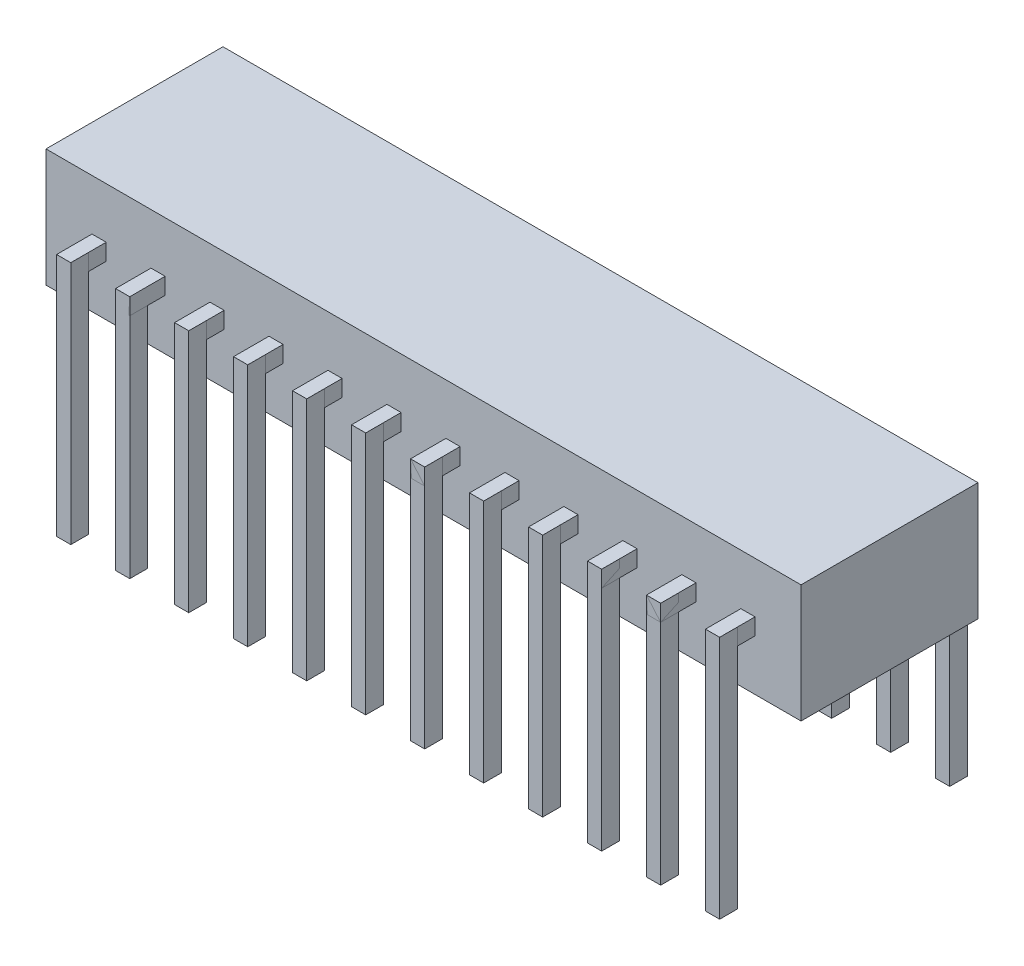
from build123d import *

# Parameters (mm, degrees)
SKETCH2_W                   = 600
SKETCH2_H                   = 1500
BOSS_EXTRUDE1_DEPTH         = 350
BOSS_EXTRUDE1_2_DEPTH       = 350
BOSS_EXTRUDE1_3_DEPTH       = 350
BOSS_EXTRUDE1_4_DEPTH       = 350
BOSS_EXTRUDE1_5_DEPTH       = 350
BOSS_EXTRUDE1_6_DEPTH       = 350
BOSS_EXTRUDE1_7_DEPTH       = 350
BOSS_EXTRUDE1_8_DEPTH       = 350
BOSS_EXTRUDE1_9_DEPTH       = 350
BOSS_EXTRUDE1_10_DEPTH      = 350
BOSS_EXTRUDE1_11_DEPTH      = 350
BOSS_EXTRUDE1_12_DEPTH      = 350
BOSS_EXTRUDE1_13_DEPTH      = 350
BOSS_EXTRUDE1_14_DEPTH      = 350
BOSS_EXTRUDE1_15_DEPTH      = 350
BOSS_EXTRUDE1_16_DEPTH      = 350
BOSS_EXTRUDE1_17_DEPTH      = 350
BOSS_EXTRUDE1_18_DEPTH      = 350
BOSS_EXTRUDE1_19_DEPTH      = 350
BOSS_EXTRUDE1_20_DEPTH      = 350
BOSS_EXTRUDE1_21_DEPTH      = 350
BOSS_EXTRUDE1_22_DEPTH      = 350
BOSS_EXTRUDE1_23_DEPTH      = 350
BOSS_EXTRUDE1_24_DEPTH      = 350
BOSS_EXTRUDE2_DEPTH         = 345
BOSS_EXTRUDE2_DEPTH_BACK    = 10000
SKETCH2_16_W                = 600
SKETCH2_16_H                = 750
BOSS_EXTRUDE2_2_DEPTH       = 345
BOSS_EXTRUDE2_2_DEPTH_BACK  = 10000
BOSS_EXTRUDE2_3_DEPTH       = 345
BOSS_EXTRUDE2_3_DEPTH_BACK  = 10000
BOSS_EXTRUDE2_4_DEPTH       = 345
BOSS_EXTRUDE2_4_DEPTH_BACK  = 10000
BOSS_EXTRUDE2_5_DEPTH       = 345
BOSS_EXTRUDE2_5_DEPTH_BACK  = 10000
BOSS_EXTRUDE2_6_DEPTH       = 345
BOSS_EXTRUDE2_6_DEPTH_BACK  = 10000
BOSS_EXTRUDE2_7_DEPTH       = 345
BOSS_EXTRUDE2_7_DEPTH_BACK  = 10000
BOSS_EXTRUDE2_8_DEPTH       = 345
BOSS_EXTRUDE2_8_DEPTH_BACK  = 10000
BOSS_EXTRUDE2_9_DEPTH       = 345
BOSS_EXTRUDE2_9_DEPTH_BACK  = 10000
BOSS_EXTRUDE2_10_DEPTH      = 345
BOSS_EXTRUDE2_10_DEPTH_BACK = 10000
BOSS_EXTRUDE2_11_DEPTH      = 345
BOSS_EXTRUDE2_11_DEPTH_BACK = 10000
BOSS_EXTRUDE2_12_DEPTH      = 345
BOSS_EXTRUDE2_12_DEPTH_BACK = 10000
BOSS_EXTRUDE2_13_DEPTH      = 345
BOSS_EXTRUDE2_13_DEPTH_BACK = 10000
BOSS_EXTRUDE2_14_DEPTH      = 345
BOSS_EXTRUDE2_14_DEPTH_BACK = 10000
BOSS_EXTRUDE2_15_DEPTH      = 345
BOSS_EXTRUDE2_15_DEPTH_BACK = 10000
BOSS_EXTRUDE2_16_DEPTH      = 345
BOSS_EXTRUDE2_16_DEPTH_BACK = 10000
BOSS_EXTRUDE2_17_DEPTH      = 345
BOSS_EXTRUDE2_17_DEPTH_BACK = 10000
BOSS_EXTRUDE2_18_DEPTH      = 345
BOSS_EXTRUDE2_18_DEPTH_BACK = 10000
BOSS_EXTRUDE2_19_DEPTH      = 345
BOSS_EXTRUDE2_19_DEPTH_BACK = 10000
BOSS_EXTRUDE2_20_DEPTH      = 345
BOSS_EXTRUDE2_20_DEPTH_BACK = 10000
BOSS_EXTRUDE2_21_DEPTH      = 345
BOSS_EXTRUDE2_21_DEPTH_BACK = 10000
BOSS_EXTRUDE2_22_DEPTH      = 345
BOSS_EXTRUDE2_22_DEPTH_BACK = 10000
BOSS_EXTRUDE2_23_DEPTH      = 345
BOSS_EXTRUDE2_23_DEPTH_BACK = 10000
BOSS_EXTRUDE2_24_DEPTH      = 345
BOSS_EXTRUDE2_24_DEPTH_BACK = 10000
BOSS_EXTRUDE3_DEPTH         = 2500


with BuildPart() as part:
    # Sketch2 → Boss-Extrude1 (new, symmetric)
    with BuildSketch(Plane(origin=(0, 0, 0), x_dir=(1, 0, 0), z_dir=(0, 1, 0))):
        with Locations((-5559.113014932, 2882.222515523)):
            Rectangle(SKETCH2_W, SKETCH2_H)
    extrude(amount=BOSS_EXTRUDE1_DEPTH, both=True)


with BuildPart() as body_2:
    # Sketch2 → Boss-Extrude1 2 (new, symmetric)
    with BuildSketch(Plane(origin=(0, 0, 0), x_dir=(1, 0, 0), z_dir=(0, 1, 0))):
        with Locations((-559.113014932, 2882.222515523)):
            Rectangle(SKETCH2_W, SKETCH2_H)
    extrude(amount=BOSS_EXTRUDE1_2_DEPTH, both=True)


with BuildPart() as body_3:
    # Sketch2 → Boss-Extrude1 3 (new, symmetric)
    with BuildSketch(Plane(origin=(0, 0, 0), x_dir=(1, 0, 0), z_dir=(0, 1, 0))):
        with Locations((-3059.113014932, 2882.222515523)):
            Rectangle(SKETCH2_W, SKETCH2_H)
    extrude(amount=BOSS_EXTRUDE1_3_DEPTH, both=True)


with BuildPart() as body_4:
    # Sketch2 → Boss-Extrude1 4 (new, symmetric)
    with BuildSketch(Plane(origin=(0, 0, 0), x_dir=(1, 0, 0), z_dir=(0, 1, 0))):
        with Locations((-8059.113014932, 2882.222515523)):
            Rectangle(SKETCH2_W, SKETCH2_H)
    extrude(amount=BOSS_EXTRUDE1_4_DEPTH, both=True)


with BuildPart() as body_5:
    # Sketch2 → Boss-Extrude1 5 (new, symmetric)
    with BuildSketch(Plane(origin=(0, 0, 0), x_dir=(1, 0, 0), z_dir=(0, 1, 0))):
        with Locations((-10559.113014932, 2882.222515523)):
            Rectangle(SKETCH2_W, SKETCH2_H)
    extrude(amount=BOSS_EXTRUDE1_5_DEPTH, both=True)


with BuildPart() as body_6:
    # Sketch2 → Boss-Extrude1 6 (new, symmetric)
    with BuildSketch(Plane(origin=(0, 0, 0), x_dir=(1, 0, 0), z_dir=(0, 1, 0))):
        with Locations((-13059.113014932, 2882.222515523)):
            Rectangle(SKETCH2_W, SKETCH2_H)
    extrude(amount=BOSS_EXTRUDE1_6_DEPTH, both=True)


with BuildPart() as body_7:
    # Sketch2 → Boss-Extrude1 7 (new, symmetric)
    with BuildSketch(Plane(origin=(0, 0, 0), x_dir=(1, 0, 0), z_dir=(0, 1, 0))):
        with Locations((-15559.113014932, 2882.222515523)):
            Rectangle(SKETCH2_W, SKETCH2_H)
    extrude(amount=BOSS_EXTRUDE1_7_DEPTH, both=True)


with BuildPart() as body_8:
    # Sketch2 → Boss-Extrude1 8 (new, symmetric)
    with BuildSketch(Plane(origin=(0, 0, 0), x_dir=(1, 0, 0), z_dir=(0, 1, 0))):
        with Locations((-18059.113014932, 2882.222515523)):
            Rectangle(SKETCH2_W, SKETCH2_H)
    extrude(amount=BOSS_EXTRUDE1_8_DEPTH, both=True)


with BuildPart() as body_9:
    # Sketch2 → Boss-Extrude1 9 (new, symmetric)
    with BuildSketch(Plane(origin=(0, 0, 0), x_dir=(1, 0, 0), z_dir=(0, 1, 0))):
        with Locations((-13059.113014932, 11882.222515523)):
            Rectangle(SKETCH2_W, SKETCH2_H)
    extrude(amount=BOSS_EXTRUDE1_9_DEPTH, both=True)


with BuildPart() as body_10:
    # Sketch2 → Boss-Extrude1 10 (new, symmetric)
    with BuildSketch(Plane(origin=(0, 0, 0), x_dir=(1, 0, 0), z_dir=(0, 1, 0))):
        with Locations((-18059.113014932, 11882.222515523)):
            Rectangle(SKETCH2_W, SKETCH2_H)
    extrude(amount=BOSS_EXTRUDE1_10_DEPTH, both=True)


with BuildPart() as body_11:
    # Sketch2 → Boss-Extrude1 11 (new, symmetric)
    with BuildSketch(Plane(origin=(0, 0, 0), x_dir=(1, 0, 0), z_dir=(0, 1, 0))):
        with Locations((-15559.113014932, 11882.222515523)):
            Rectangle(SKETCH2_W, SKETCH2_H)
    extrude(amount=BOSS_EXTRUDE1_11_DEPTH, both=True)


with BuildPart() as body_12:
    # Sketch2 → Boss-Extrude1 12 (new, symmetric)
    with BuildSketch(Plane(origin=(0, 0, 0), x_dir=(1, 0, 0), z_dir=(0, 1, 0))):
        with Locations((-10559.113014932, 11882.222515523)):
            Rectangle(SKETCH2_W, SKETCH2_H)
    extrude(amount=BOSS_EXTRUDE1_12_DEPTH, both=True)


with BuildPart() as body_13:
    # Sketch2 → Boss-Extrude1 13 (new, symmetric)
    with BuildSketch(Plane(origin=(0, 0, 0), x_dir=(1, 0, 0), z_dir=(0, 1, 0))):
        with Locations((-8059.113014932, 11882.222515523)):
            Rectangle(SKETCH2_W, SKETCH2_H)
    extrude(amount=BOSS_EXTRUDE1_13_DEPTH, both=True)


with BuildPart() as body_14:
    # Sketch2 → Boss-Extrude1 14 (new, symmetric)
    with BuildSketch(Plane(origin=(0, 0, 0), x_dir=(1, 0, 0), z_dir=(0, 1, 0))):
        with Locations((-5559.113014932, 11882.222515523)):
            Rectangle(SKETCH2_W, SKETCH2_H)
    extrude(amount=BOSS_EXTRUDE1_14_DEPTH, both=True)


with BuildPart() as body_15:
    # Sketch2 → Boss-Extrude1 15 (new, symmetric)
    with BuildSketch(Plane(origin=(0, 0, 0), x_dir=(1, 0, 0), z_dir=(0, 1, 0))):
        with Locations((-3059.113014932, 11882.222515523)):
            Rectangle(SKETCH2_W, SKETCH2_H)
    extrude(amount=BOSS_EXTRUDE1_15_DEPTH, both=True)


with BuildPart() as body_16:
    # Sketch2 → Boss-Extrude1 16 (new, symmetric)
    with BuildSketch(Plane(origin=(0, 0, 0), x_dir=(1, 0, 0), z_dir=(0, 1, 0))):
        with Locations((-559.113014932, 11882.222515523)):
            Rectangle(SKETCH2_W, SKETCH2_H)
    extrude(amount=BOSS_EXTRUDE1_16_DEPTH, both=True)


with BuildPart() as body_17:
    # Sketch2 → Boss-Extrude1 17 (new, symmetric)
    with BuildSketch(Plane(origin=(0, 0, 0), x_dir=(1, 0, 0), z_dir=(0, 1, 0))):
        with Locations((6940.886985068, 11882.222515523)):
            Rectangle(SKETCH2_W, SKETCH2_H)
    extrude(amount=BOSS_EXTRUDE1_17_DEPTH, both=True)


with BuildPart() as body_18:
    # Sketch2 → Boss-Extrude1 18 (new, symmetric)
    with BuildSketch(Plane(origin=(0, 0, 0), x_dir=(1, 0, 0), z_dir=(0, 1, 0))):
        with Locations((1940.886985068, 11882.222515523)):
            Rectangle(SKETCH2_W, SKETCH2_H)
    extrude(amount=BOSS_EXTRUDE1_18_DEPTH, both=True)


with BuildPart() as body_19:
    # Sketch2 → Boss-Extrude1 19 (new, symmetric)
    with BuildSketch(Plane(origin=(0, 0, 0), x_dir=(1, 0, 0), z_dir=(0, 1, 0))):
        with Locations((4440.886985068, 11882.222515523)):
            Rectangle(SKETCH2_W, SKETCH2_H)
    extrude(amount=BOSS_EXTRUDE1_19_DEPTH, both=True)


with BuildPart() as body_20:
    # Sketch2 → Boss-Extrude1 20 (new, symmetric)
    with BuildSketch(Plane(origin=(0, 0, 0), x_dir=(1, 0, 0), z_dir=(0, 1, 0))):
        with Locations((9440.886985068, 11882.222515523)):
            Rectangle(SKETCH2_W, SKETCH2_H)
    extrude(amount=BOSS_EXTRUDE1_20_DEPTH, both=True)


with BuildPart() as body_21:
    # Sketch2 → Boss-Extrude1 21 (new, symmetric)
    with BuildSketch(Plane(origin=(0, 0, 0), x_dir=(1, 0, 0), z_dir=(0, 1, 0))):
        with Locations((9440.886985068, 2882.222515523)):
            Rectangle(SKETCH2_W, SKETCH2_H)
    extrude(amount=BOSS_EXTRUDE1_21_DEPTH, both=True)


with BuildPart() as body_22:
    # Sketch2 → Boss-Extrude1 22 (new, symmetric)
    with BuildSketch(Plane(origin=(0, 0, 0), x_dir=(1, 0, 0), z_dir=(0, 1, 0))):
        with Locations((6940.886985068, 2882.222515523)):
            Rectangle(SKETCH2_W, SKETCH2_H)
    extrude(amount=BOSS_EXTRUDE1_22_DEPTH, both=True)


with BuildPart() as body_23:
    # Sketch2 → Boss-Extrude1 23 (new, symmetric)
    with BuildSketch(Plane(origin=(0, 0, 0), x_dir=(1, 0, 0), z_dir=(0, 1, 0))):
        with Locations((4440.886985068, 2882.222515523)):
            Rectangle(SKETCH2_W, SKETCH2_H)
    extrude(amount=BOSS_EXTRUDE1_23_DEPTH, both=True)


with BuildPart() as body_24:
    # Sketch2 → Boss-Extrude1 24 (new, symmetric)
    with BuildSketch(Plane(origin=(0, 0, 0), x_dir=(1, 0, 0), z_dir=(0, 1, 0))):
        with Locations((1940.886985068, 2882.222515523)):
            Rectangle(SKETCH2_W, SKETCH2_H)
    extrude(amount=BOSS_EXTRUDE1_24_DEPTH, both=True)


with BuildPart() as body_25:
    # Sketch2<16> → Boss-Extrude2 (new, two sides: drawn at the far end of the back side and taken through both)
    with BuildSketch(Plane(origin=(0, 0, 0), x_dir=(1, 0, 0), z_dir=(0, 1, 0)).offset(-BOSS_EXTRUDE2_DEPTH_BACK)):
        with Locations((-18059.113014932, 12257.222515523)):
            Rectangle(SKETCH2_16_W, SKETCH2_16_H)
    extrude(amount=BOSS_EXTRUDE2_DEPTH + BOSS_EXTRUDE2_DEPTH_BACK)


with BuildPart() as body_26:
    # Sketch2<16> → Boss-Extrude2 2 (new, two sides: drawn at the far end of the back side and taken through both)
    with BuildSketch(Plane(origin=(0, 0, 0), x_dir=(1, 0, 0), z_dir=(0, 1, 0)).offset(-BOSS_EXTRUDE2_2_DEPTH_BACK)):
        with Locations((-18059.113014932, 2507.222515523)):
            Rectangle(SKETCH2_16_W, SKETCH2_16_H)
    extrude(amount=BOSS_EXTRUDE2_2_DEPTH + BOSS_EXTRUDE2_2_DEPTH_BACK)


with BuildPart() as body_27:
    # Sketch2<16> → Boss-Extrude2 3 (new, two sides: drawn at the far end of the back side and taken through both)
    with BuildSketch(Plane(origin=(0, 0, 0), x_dir=(1, 0, 0), z_dir=(0, 1, 0)).offset(-BOSS_EXTRUDE2_3_DEPTH_BACK)):
        with Locations((-15559.113014932, 12257.222515523)):
            Rectangle(SKETCH2_16_W, SKETCH2_16_H)
    extrude(amount=BOSS_EXTRUDE2_3_DEPTH + BOSS_EXTRUDE2_3_DEPTH_BACK)


with BuildPart() as body_28:
    # Sketch2<16> → Boss-Extrude2 4 (new, two sides: drawn at the far end of the back side and taken through both)
    with BuildSketch(Plane(origin=(0, 0, 0), x_dir=(1, 0, 0), z_dir=(0, 1, 0)).offset(-BOSS_EXTRUDE2_4_DEPTH_BACK)):
        with Locations((-15559.113014932, 2507.222515523)):
            Rectangle(SKETCH2_16_W, SKETCH2_16_H)
    extrude(amount=BOSS_EXTRUDE2_4_DEPTH + BOSS_EXTRUDE2_4_DEPTH_BACK)


with BuildPart() as body_29:
    # Sketch2<16> → Boss-Extrude2 5 (new, two sides: drawn at the far end of the back side and taken through both)
    with BuildSketch(Plane(origin=(0, 0, 0), x_dir=(1, 0, 0), z_dir=(0, 1, 0)).offset(-BOSS_EXTRUDE2_5_DEPTH_BACK)):
        with Locations((-13059.113014932, 12257.222515523)):
            Rectangle(SKETCH2_16_W, SKETCH2_16_H)
    extrude(amount=BOSS_EXTRUDE2_5_DEPTH + BOSS_EXTRUDE2_5_DEPTH_BACK)


with BuildPart() as body_30:
    # Sketch2<16> → Boss-Extrude2 6 (new, two sides: drawn at the far end of the back side and taken through both)
    with BuildSketch(Plane(origin=(0, 0, 0), x_dir=(1, 0, 0), z_dir=(0, 1, 0)).offset(-BOSS_EXTRUDE2_6_DEPTH_BACK)):
        with Locations((-13059.113014932, 2507.222515523)):
            Rectangle(SKETCH2_16_W, SKETCH2_16_H)
    extrude(amount=BOSS_EXTRUDE2_6_DEPTH + BOSS_EXTRUDE2_6_DEPTH_BACK)


with BuildPart() as body_31:
    # Sketch2<16> → Boss-Extrude2 7 (new, two sides: drawn at the far end of the back side and taken through both)
    with BuildSketch(Plane(origin=(0, 0, 0), x_dir=(1, 0, 0), z_dir=(0, 1, 0)).offset(-BOSS_EXTRUDE2_7_DEPTH_BACK)):
        with Locations((-10559.113014932, 12257.222515523)):
            Rectangle(SKETCH2_16_W, SKETCH2_16_H)
    extrude(amount=BOSS_EXTRUDE2_7_DEPTH + BOSS_EXTRUDE2_7_DEPTH_BACK)


with BuildPart() as body_32:
    # Sketch2<16> → Boss-Extrude2 8 (new, two sides: drawn at the far end of the back side and taken through both)
    with BuildSketch(Plane(origin=(0, 0, 0), x_dir=(1, 0, 0), z_dir=(0, 1, 0)).offset(-BOSS_EXTRUDE2_8_DEPTH_BACK)):
        with Locations((-10559.113014932, 2507.222515523)):
            Rectangle(SKETCH2_16_W, SKETCH2_16_H)
    extrude(amount=BOSS_EXTRUDE2_8_DEPTH + BOSS_EXTRUDE2_8_DEPTH_BACK)


with BuildPart() as body_33:
    # Sketch2<16> → Boss-Extrude2 9 (new, two sides: drawn at the far end of the back side and taken through both)
    with BuildSketch(Plane(origin=(0, 0, 0), x_dir=(1, 0, 0), z_dir=(0, 1, 0)).offset(-BOSS_EXTRUDE2_9_DEPTH_BACK)):
        with Locations((-8059.113014932, 12257.222515523)):
            Rectangle(SKETCH2_16_W, SKETCH2_16_H)
    extrude(amount=BOSS_EXTRUDE2_9_DEPTH + BOSS_EXTRUDE2_9_DEPTH_BACK)


with BuildPart() as body_34:
    # Sketch2<16> → Boss-Extrude2 10 (new, two sides: drawn at the far end of the back side and taken through both)
    with BuildSketch(Plane(origin=(0, 0, 0), x_dir=(1, 0, 0), z_dir=(0, 1, 0)).offset(-BOSS_EXTRUDE2_10_DEPTH_BACK)):
        with Locations((-8059.113014932, 2507.222515523)):
            Rectangle(SKETCH2_16_W, SKETCH2_16_H)
    extrude(amount=BOSS_EXTRUDE2_10_DEPTH + BOSS_EXTRUDE2_10_DEPTH_BACK)


with BuildPart() as body_35:
    # Sketch2<16> → Boss-Extrude2 11 (new, two sides: drawn at the far end of the back side and taken through both)
    with BuildSketch(Plane(origin=(0, 0, 0), x_dir=(1, 0, 0), z_dir=(0, 1, 0)).offset(-BOSS_EXTRUDE2_11_DEPTH_BACK)):
        with Locations((-5559.113014932, 12257.222515523)):
            Rectangle(SKETCH2_16_W, SKETCH2_16_H)
    extrude(amount=BOSS_EXTRUDE2_11_DEPTH + BOSS_EXTRUDE2_11_DEPTH_BACK)


with BuildPart() as body_36:
    # Sketch2<16> → Boss-Extrude2 12 (new, two sides: drawn at the far end of the back side and taken through both)
    with BuildSketch(Plane(origin=(0, 0, 0), x_dir=(1, 0, 0), z_dir=(0, 1, 0)).offset(-BOSS_EXTRUDE2_12_DEPTH_BACK)):
        with Locations((-5559.113014932, 2507.222515523)):
            Rectangle(SKETCH2_16_W, SKETCH2_16_H)
    extrude(amount=BOSS_EXTRUDE2_12_DEPTH + BOSS_EXTRUDE2_12_DEPTH_BACK)


with BuildPart() as body_37:
    # Sketch2<16> → Boss-Extrude2 13 (new, two sides: drawn at the far end of the back side and taken through both)
    with BuildSketch(Plane(origin=(0, 0, 0), x_dir=(1, 0, 0), z_dir=(0, 1, 0)).offset(-BOSS_EXTRUDE2_13_DEPTH_BACK)):
        with Locations((-3059.113014932, 12257.222515523)):
            Rectangle(SKETCH2_16_W, SKETCH2_16_H)
    extrude(amount=BOSS_EXTRUDE2_13_DEPTH + BOSS_EXTRUDE2_13_DEPTH_BACK)


with BuildPart() as body_38:
    # Sketch2<16> → Boss-Extrude2 14 (new, two sides: drawn at the far end of the back side and taken through both)
    with BuildSketch(Plane(origin=(0, 0, 0), x_dir=(1, 0, 0), z_dir=(0, 1, 0)).offset(-BOSS_EXTRUDE2_14_DEPTH_BACK)):
        with Locations((-3059.113014932, 2507.222515523)):
            Rectangle(SKETCH2_16_W, SKETCH2_16_H)
    extrude(amount=BOSS_EXTRUDE2_14_DEPTH + BOSS_EXTRUDE2_14_DEPTH_BACK)


with BuildPart() as body_39:
    # Sketch2<16> → Boss-Extrude2 15 (new, two sides: drawn at the far end of the back side and taken through both)
    with BuildSketch(Plane(origin=(0, 0, 0), x_dir=(1, 0, 0), z_dir=(0, 1, 0)).offset(-BOSS_EXTRUDE2_15_DEPTH_BACK)):
        with Locations((-559.113014932, 12257.222515523)):
            Rectangle(SKETCH2_16_W, SKETCH2_16_H)
    extrude(amount=BOSS_EXTRUDE2_15_DEPTH + BOSS_EXTRUDE2_15_DEPTH_BACK)


with BuildPart() as body_40:
    # Sketch2<16> → Boss-Extrude2 16 (new, two sides: drawn at the far end of the back side and taken through both)
    with BuildSketch(Plane(origin=(0, 0, 0), x_dir=(1, 0, 0), z_dir=(0, 1, 0)).offset(-BOSS_EXTRUDE2_16_DEPTH_BACK)):
        with Locations((-559.113014932, 2507.222515523)):
            Rectangle(SKETCH2_16_W, SKETCH2_16_H)
    extrude(amount=BOSS_EXTRUDE2_16_DEPTH + BOSS_EXTRUDE2_16_DEPTH_BACK)


with BuildPart() as body_41:
    # Sketch2<16> → Boss-Extrude2 17 (new, two sides: drawn at the far end of the back side and taken through both)
    with BuildSketch(Plane(origin=(0, 0, 0), x_dir=(1, 0, 0), z_dir=(0, 1, 0)).offset(-BOSS_EXTRUDE2_17_DEPTH_BACK)):
        with Locations((1940.886985068, 12257.222515523)):
            Rectangle(SKETCH2_16_W, SKETCH2_16_H)
    extrude(amount=BOSS_EXTRUDE2_17_DEPTH + BOSS_EXTRUDE2_17_DEPTH_BACK)


with BuildPart() as body_42:
    # Sketch2<16> → Boss-Extrude2 18 (new, two sides: drawn at the far end of the back side and taken through both)
    with BuildSketch(Plane(origin=(0, 0, 0), x_dir=(1, 0, 0), z_dir=(0, 1, 0)).offset(-BOSS_EXTRUDE2_18_DEPTH_BACK)):
        with Locations((1940.886985068, 2507.222515523)):
            Rectangle(SKETCH2_16_W, SKETCH2_16_H)
    extrude(amount=BOSS_EXTRUDE2_18_DEPTH + BOSS_EXTRUDE2_18_DEPTH_BACK)


with BuildPart() as body_43:
    # Sketch2<16> → Boss-Extrude2 19 (new, two sides: drawn at the far end of the back side and taken through both)
    with BuildSketch(Plane(origin=(0, 0, 0), x_dir=(1, 0, 0), z_dir=(0, 1, 0)).offset(-BOSS_EXTRUDE2_19_DEPTH_BACK)):
        with Locations((4440.886985068, 12257.222515523)):
            Rectangle(SKETCH2_16_W, SKETCH2_16_H)
    extrude(amount=BOSS_EXTRUDE2_19_DEPTH + BOSS_EXTRUDE2_19_DEPTH_BACK)


with BuildPart() as body_44:
    # Sketch2<16> → Boss-Extrude2 20 (new, two sides: drawn at the far end of the back side and taken through both)
    with BuildSketch(Plane(origin=(0, 0, 0), x_dir=(1, 0, 0), z_dir=(0, 1, 0)).offset(-BOSS_EXTRUDE2_20_DEPTH_BACK)):
        with Locations((4440.886985068, 2507.222515523)):
            Rectangle(SKETCH2_16_W, SKETCH2_16_H)
    extrude(amount=BOSS_EXTRUDE2_20_DEPTH + BOSS_EXTRUDE2_20_DEPTH_BACK)


with BuildPart() as body_45:
    # Sketch2<16> → Boss-Extrude2 21 (new, two sides: drawn at the far end of the back side and taken through both)
    with BuildSketch(Plane(origin=(0, 0, 0), x_dir=(1, 0, 0), z_dir=(0, 1, 0)).offset(-BOSS_EXTRUDE2_21_DEPTH_BACK)):
        with Locations((6940.886985068, 12257.222515523)):
            Rectangle(SKETCH2_16_W, SKETCH2_16_H)
    extrude(amount=BOSS_EXTRUDE2_21_DEPTH + BOSS_EXTRUDE2_21_DEPTH_BACK)


with BuildPart() as body_46:
    # Sketch2<16> → Boss-Extrude2 22 (new, two sides: drawn at the far end of the back side and taken through both)
    with BuildSketch(Plane(origin=(0, 0, 0), x_dir=(1, 0, 0), z_dir=(0, 1, 0)).offset(-BOSS_EXTRUDE2_22_DEPTH_BACK)):
        with Locations((6940.886985068, 2507.222515523)):
            Rectangle(SKETCH2_16_W, SKETCH2_16_H)
    extrude(amount=BOSS_EXTRUDE2_22_DEPTH + BOSS_EXTRUDE2_22_DEPTH_BACK)


with BuildPart() as body_47:
    # Sketch2<16> → Boss-Extrude2 23 (new, two sides: drawn at the far end of the back side and taken through both)
    with BuildSketch(Plane(origin=(0, 0, 0), x_dir=(1, 0, 0), z_dir=(0, 1, 0)).offset(-BOSS_EXTRUDE2_23_DEPTH_BACK)):
        with Locations((9440.886985068, 12257.222515523)):
            Rectangle(SKETCH2_16_W, SKETCH2_16_H)
    extrude(amount=BOSS_EXTRUDE2_23_DEPTH + BOSS_EXTRUDE2_23_DEPTH_BACK)


with BuildPart() as body_48:
    # Sketch2<16> → Boss-Extrude2 24 (new, two sides: drawn at the far end of the back side and taken through both)
    with BuildSketch(Plane(origin=(0, 0, 0), x_dir=(1, 0, 0), z_dir=(0, 1, 0)).offset(-BOSS_EXTRUDE2_24_DEPTH_BACK)):
        with Locations((9440.886985068, 2507.222515523)):
            Rectangle(SKETCH2_16_W, SKETCH2_16_H)
    extrude(amount=BOSS_EXTRUDE2_24_DEPTH + BOSS_EXTRUDE2_24_DEPTH_BACK)


with BuildPart() as body_49:
    # Sketch2<17> → Boss-Extrude3 (new, symmetric)
    with BuildSketch(Plane(origin=(0, 0, 0), x_dir=(1, 0, 0), z_dir=(0, 1, 0))):
        Polygon((-18359.113014932, 11132.222515523), (-20309.113014932, 11132.222515523), (-20309.113014932, 3632.222515523), (-18359.113014932, 3632.222515523), (-17759.113014932, 3632.222515523), (-15859.113014932, 3632.222515523), (-15259.113014932, 3632.222515523), (-13359.113014932, 3632.222515523), (-12759.113014932, 3632.222515523), (-10859.113014932, 3632.222515523), (-10259.113014932, 3632.222515523), (-8359.113014932, 3632.222515523), (-7759.113014932, 3632.222515523), (-5859.113014932, 3632.222515523), (-5259.113014932, 3632.222515523), (-3359.113014932, 3632.222515523), (-2759.113014932, 3632.222515523), (-859.113014932, 3632.222515523), (-259.113014932, 3632.222515523), (1640.886985068, 3632.222515523), (2240.886985068, 3632.222515523), (4140.886985068, 3632.222515523), (4740.886985068, 3632.222515523), (6640.886985068, 3632.222515523), (7240.886985068, 3632.222515523), (9140.886985068, 3632.222515523), (9740.886985068, 3632.222515523), (11690.886985068, 3632.222515523), (11690.886985068, 11132.222515523), (9740.886985068, 11132.222515523), (9140.886985068, 11132.222515523), (7240.886985068, 11132.222515523), (6640.886985068, 11132.222515523), (4740.886985068, 11132.222515523), (4140.886985068, 11132.222515523), (2240.886985068, 11132.222515523), (1640.886985068, 11132.222515523), (-259.113014932, 11132.222515523), (-859.113014932, 11132.222515523), (-2759.113014932, 11132.222515523), (-3359.113014932, 11132.222515523), (-5259.113014932, 11132.222515523), (-5859.113014932, 11132.222515523), (-7759.113014932, 11132.222515523), (-8359.113014932, 11132.222515523), (-10259.113014932, 11132.222515523), (-10859.113014932, 11132.222515523), (-12759.113014932, 11132.222515523), (-13359.113014932, 11132.222515523), (-15259.113014932, 11132.222515523), (-15859.113014932, 11132.222515523), (-17759.113014932, 11132.222515523), align=None)
    extrude(amount=BOSS_EXTRUDE3_DEPTH, both=True)


solid = Compound([part.part, body_2.part, body_3.part, body_4.part, body_5.part, body_6.part, body_7.part, body_8.part, body_9.part, body_10.part, body_11.part, body_12.part, body_13.part, body_14.part, body_15.part, body_16.part, body_17.part, body_18.part, body_19.part, body_20.part, body_21.part, body_22.part, body_23.part, body_24.part, body_25.part, body_26.part, body_27.part, body_28.part, body_29.part, body_30.part, body_31.part, body_32.part, body_33.part, body_34.part, body_35.part, body_36.part, body_37.part, body_38.part, body_39.part, body_40.part, body_41.part, body_42.part, body_43.part, body_44.part, body_45.part, body_46.part, body_47.part, body_48.part, body_49.part])
